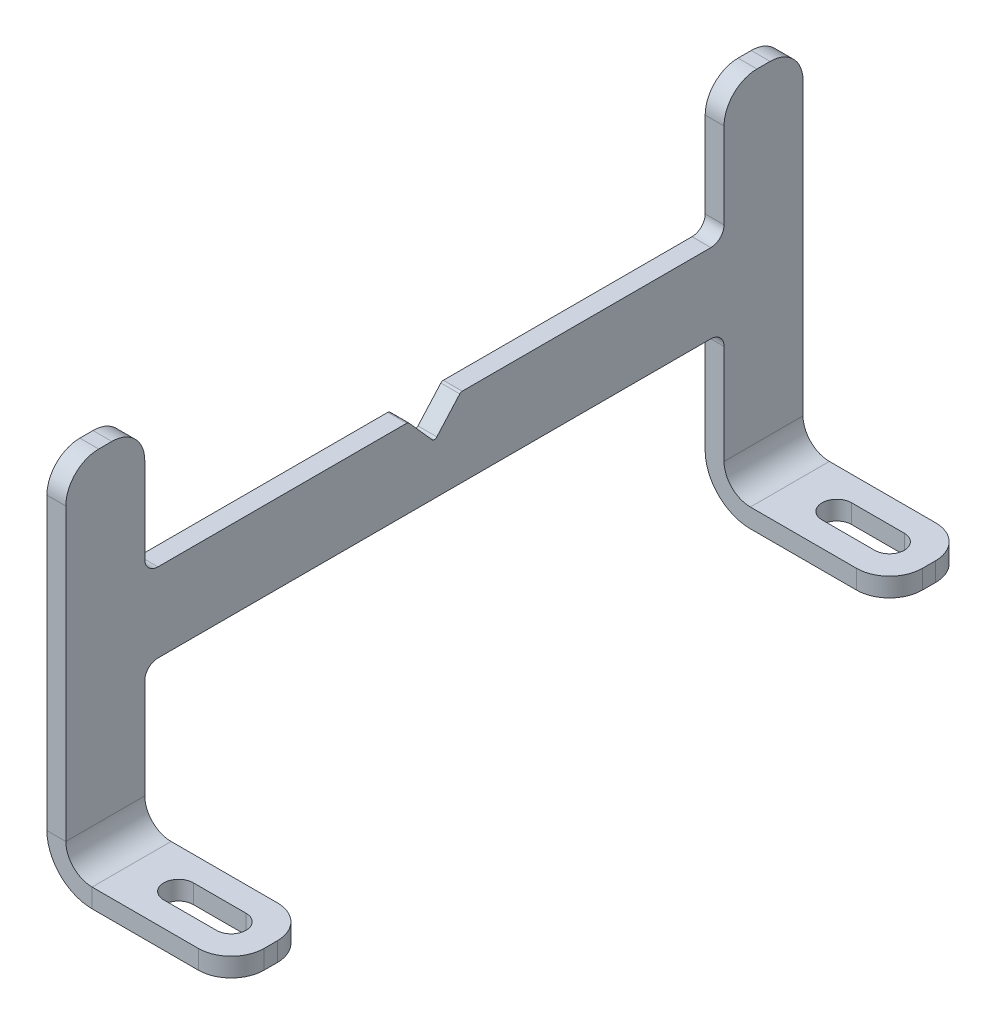
from build123d import *

# Parameters (mm, degrees)
BASE_FLANGE1_DEPTH = 88.9
EXTRUDE2_REACH     = 132.358
EXTRUDE3_REACH     = 133.902
EXTRUDE4_DEPTH     = 134.35
FILLET1_R          = 7.9375
CUT_EXTRUDE1_REACH = 133.902
FILLET2_R          = 0.79375


# Sheet-metal steps are written as plain solids
with BuildPart() as part:
    # Sketch1 → Base-Flange1 (new, symmetric)
    with BuildSketch(Plane.XY):
        with BuildLine():
            Line((0, 88.9), (0, 10.90422))
            ThreePointArc((0, 10.90422), (3.193772094, 3.193772094), (10.90422, 0))
            Line((10.90422, 0), (44.45, 0))
            Line((44.45, 0), (44.45, 4.55422))
            Line((44.45, 4.55422), (10.90422, 4.55422))
            ThreePointArc((10.90422, 4.55422), (6.414091939, 6.414091939), (4.55422, 10.90422))
            Line((4.55422, 10.90422), (4.55422, 88.9))
            Line((4.55422, 88.9), (0, 88.9))
        make_face()
    extrude(amount=BASE_FLANGE1_DEPTH, both=True)

    # Sketch3 → Extrude2 (cut, up to next)
    with BuildSketch(Plane(origin=(0, 4.55422, 0), x_dir=(1, 0, 0), z_dir=(0, 1, 0)), mode=Mode.PRIVATE) as extrude2_sk1:
        with BuildLine():
            Line((34.925, -82.946875), (22.225, -82.946875))
            ThreePointArc((22.225, -82.946875), (18.653125, -79.375), (22.225, -75.803125))
            Line((22.225, -75.803125), (34.925, -75.803125))
            ThreePointArc((34.925, -75.803125), (38.496875, -79.375), (34.925, -82.946875))
        make_face()
    extrude2_tool1 = extrude(extrude2_sk1.sketch, amount=-EXTRUDE2_REACH, mode=Mode.PRIVATE) & part.part
    # Sketch3 → Extrude2 (cut, up to next)
    with BuildSketch(Plane(origin=(0, 4.55422, 0), x_dir=(1, 0, 0), z_dir=(0, 1, 0)), mode=Mode.PRIVATE) as extrude2_sk2:
        with BuildLine():
            Line((34.925, 75.803125), (22.225, 75.803125))
            ThreePointArc((22.225, 75.803125), (18.653125, 79.375), (22.225, 82.946875))
            Line((22.225, 82.946875), (34.925, 82.946875))
            ThreePointArc((34.925, 82.946875), (38.496875, 79.375), (34.925, 75.803125))
        make_face()
    extrude2_tool2 = extrude(extrude2_sk2.sketch, amount=-EXTRUDE2_REACH, mode=Mode.PRIVATE) & part.part
    add(extrude2_tool1.solids().sort_by_distance((28.575, 4.55422, 79.375))[0], mode=Mode.SUBTRACT)
    add(extrude2_tool2.solids().sort_by_distance((28.575, 4.55422, -79.375))[0], mode=Mode.SUBTRACT)

    # Sketch4 → Extrude3 (cut, up to next)
    with BuildSketch(Plane(origin=(4.55422, 0, 0), x_dir=(0, 0, -1), z_dir=(1, 0, 0)), mode=Mode.PRIVATE) as extrude3_sk1:
        with BuildLine():
            Line((-69.85, 88.9), (69.85, 88.9))
            Line((69.85, 88.9), (69.85, 60.325))
            ThreePointArc((69.85, 60.325), (68.92006403, 58.07993597), (66.675, 57.15))
            Line((66.675, 57.15), (-66.675, 57.15))
            ThreePointArc((-66.675, 57.15), (-68.92006403, 58.07993597), (-69.85, 60.325))
            Line((-69.85, 60.325), (-69.85, 88.9))
        make_face()
    extrude3_tool1 = extrude(extrude3_sk1.sketch, amount=-EXTRUDE3_REACH, mode=Mode.PRIVATE) & part.part
    add(extrude3_tool1.solids().sort_by_distance((4.55422, 73.039808, 0))[0], mode=Mode.SUBTRACT)

    # Sketch5 → Extrude4 (cut, through all)
    with BuildSketch(Plane.ZY):
        with BuildLine():
            Line((-66.675, 38.1), (66.675, 38.1))
            ThreePointArc((66.675, 38.1), (68.92006403, 37.17006403), (69.85, 34.925))
            Line((69.85, 34.925), (69.85, 0))
            Line((69.85, 0), (-69.85, 0))
            Line((-69.85, 0), (-69.85, 34.925))
            ThreePointArc((-69.85, 34.925), (-68.92006403, 37.17006403), (-66.675, 38.1))
        make_face()
    extrude(amount=-EXTRUDE4_DEPTH, mode=Mode.SUBTRACT)

    # Fillet1
    fillet1_edges = [part.edges().sort_by_distance(p)[0] for p in [
        (2.27711, 88.9, 88.9),
        (2.27711, 88.9, 69.85),
        (2.27711, 88.9, -69.85),
        (44.45, 2.27711, 88.9),
        (2.27711, 88.9, -88.9),
        (44.45, 2.27711, -88.9),
        (44.45, 2.27711, 69.85),
        (44.45, 2.27711, -69.85),
    ]]
    fillet(fillet1_edges, radius=FILLET1_R)

    # Sketch6 → Cut-Extrude1 (cut, up to next)
    with BuildSketch(Plane(origin=(4.55422, 0, 0), x_dir=(0, 0, -1), z_dir=(1, 0, 0)), mode=Mode.PRIVATE) as cut_extrude1_sk1:
        Polygon((-6.35, 57.15), (6.35, 57.15), (0, 50.00625), align=None)
    cut_extrude1_tool1 = extrude(cut_extrude1_sk1.sketch, amount=-CUT_EXTRUDE1_REACH, mode=Mode.PRIVATE) & part.part
    add(cut_extrude1_tool1.solids().sort_by_distance((4.55422, 54.76875, 0))[0], mode=Mode.SUBTRACT)

    # Fillet2
    fillet2_edges = [part.edges().sort_by_distance(p)[0] for p in [
        (2.27711, 50.00625, 0),
        (2.27711, 57.15, 6.35),
        (2.27711, 57.15, -6.35),
    ]]
    fillet(fillet2_edges, radius=FILLET2_R)


solid = part.part
